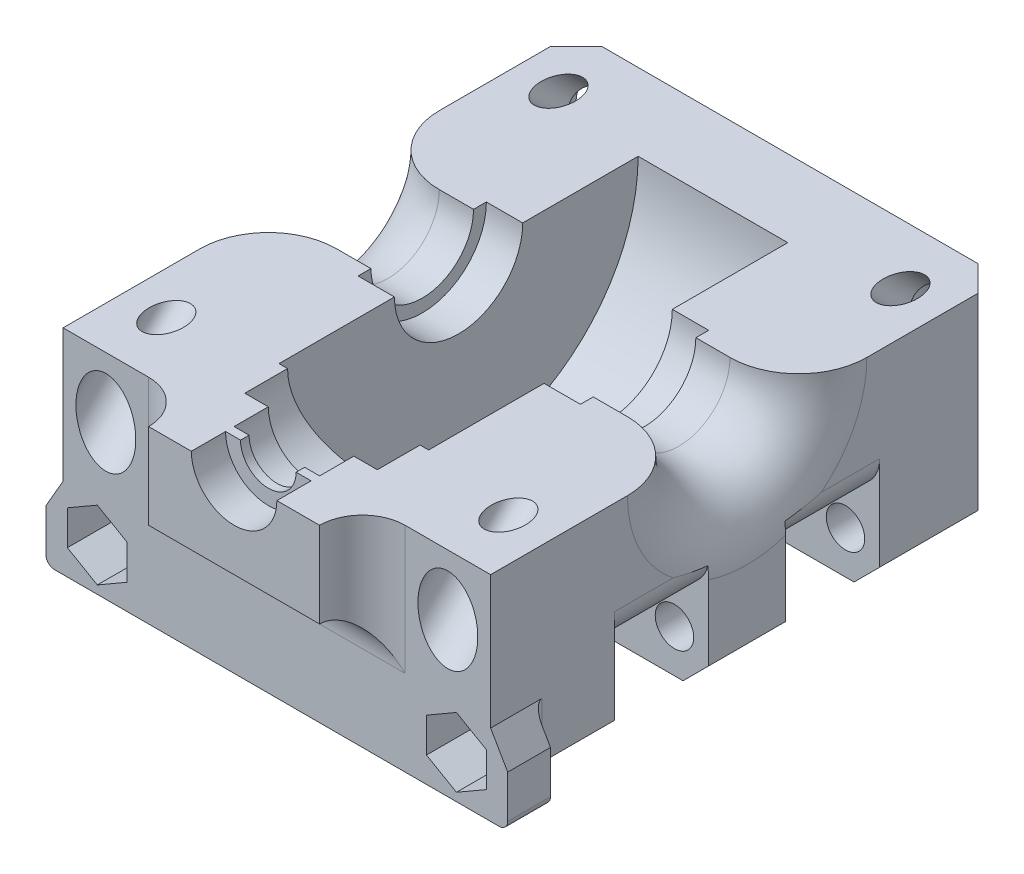
from build123d import *

# Parameters (mm, degrees)
SKETCH1_W                = 50
SKETCH1_H                = 60
BOSS_EXTRUDE1_DEPTH      = 25
CUT_EXTRUDE1_START       = -16.25
SKETCH2_R                = 21
CUT_EXTRUDE1_DEPTH       = 17.5
CUT_EXTRUDE2_START       = -12
SKETCH3_R                = 7.5
CUT_EXTRUDE2_DEPTH       = 26
SKETCH4_R                = 5
CUT_EXTRUDE3_DEPTH       = 4
SKETCH10_W               = 11
SKETCH10_H               = 10
CUT_EXTRUDE9_DEPTH       = 11
SKETCH11_R               = 2.25
CUT_EXTRUDE10_DEPTH      = 50.398886627
SKETCH12_R               = 2
CUT_EXTRUDE11_DEPTH      = 50.371044145
SKETCH13_R               = 3.5
CUT_EXTRUDE12_DEPTH      = 50.371044145
CHAMFER1_SIZE            = 3
FILLET1_R                = 4
SKETCH14_R               = 1.8
CUT_EXTRUDE13_DEPTH      = 10
CUT_EXTRUDE14_DEPTH      = 7
BOSS_EXTRUDE2_DEPTH      = 5
CHAMFER2_SIZE            = 3
FILLET2_R                = 1
CUT_EXTRUDE15_DEPTH      = 66.030761952
CUT_EXTRUDE15_DEPTH_BACK = 66.030761952
SKETCH17_R               = 6
SKETCH21_R               = 7.75
CUT_EXTRUDE16_DEPTH      = 8
SKETCH22_W               = 20
SKETCH22_H               = 10
BOSS_EXTRUDE3_DEPTH      = 5
SKETCH23_R               = 3.25
CUT_EXTRUDE17_DEPTH      = 5
SKETCH24_R               = 5
CUT_EXTRUDE18_DEPTH      = 4
FILLET4_R                = 5
SKETCH25_R               = 1.5
CUT_EXTRUDE19_DEPTH      = 8
SKETCH26_R               = 3.6
CUT_EXTRUDE20_DEPTH      = 10


with BuildPart() as part:
    # Sketch1 → Boss-Extrude1 (new body)
    with BuildSketch(Plane(origin=(0, 0, 0), x_dir=(1, 0, 0), z_dir=(0, 1, 0))):
        Rectangle(SKETCH1_W, SKETCH1_H)
    extrude(amount=BOSS_EXTRUDE1_DEPTH)

    # Sketch2 → Cut-Extrude1 (cut)
    with BuildSketch(Plane.ZY.offset(25).offset(CUT_EXTRUDE1_START)):
        with Locations((0, 25)):
            Circle(SKETCH2_R)
    extrude(amount=-CUT_EXTRUDE1_DEPTH, mode=Mode.SUBTRACT)

    # Sketch3 → Cut-Extrude2 (cut)
    with BuildSketch(Plane.ZY.offset(25).offset(CUT_EXTRUDE2_START)):
        with Locations((0, 25)):
            Circle(SKETCH3_R)
    extrude(amount=-CUT_EXTRUDE2_DEPTH, mode=Mode.SUBTRACT)

    # Sketch4 → Cut-Extrude3 (cut)
    with BuildSketch(Plane.XY.offset(30)):
        with Locations((0, 25)):
            Circle(SKETCH4_R)
    extrude(amount=-CUT_EXTRUDE3_DEPTH, mode=Mode.SUBTRACT)

    # Sketch10 → Cut-Extrude9 (cut)
    with BuildSketch(Plane(origin=(25, 0, 0), x_dir=(0, 0, -1), z_dir=(1, 0, 0))):
        with Locations((-10, 5)):
            Rectangle(SKETCH10_W, SKETCH10_H)
        with Locations((10, 5)):
            Rectangle(SKETCH10_W, SKETCH10_H)
    cut_extrude9 = extrude(amount=-CUT_EXTRUDE9_DEPTH, mode=Mode.SUBTRACT)

    # Sketch11 → Cut-Extrude10 (cut, symmetric)
    with BuildSketch(Plane(origin=(0, 0, -4.5), x_dir=(-1, 0, 0), z_dir=(0, 0, -1))):
        with Locations(Location((-21, 5, 0), (0, 0, 90))):
            Circle(SKETCH11_R)
    cut_extrude10 = extrude(amount=CUT_EXTRUDE10_DEPTH, both=True, mode=Mode.SUBTRACT)

    # Mirror1: Cut-Extrude9, Cut-Extrude10 across plane
    add(cut_extrude9.mirror(Plane(origin=(0, 0, 0), x_dir=(0, 0, 1), z_dir=(1, 0, 0))), mode=Mode.SUBTRACT)
    add(cut_extrude10.mirror(Plane(origin=(0, 0, 0), x_dir=(0, 0, 1), z_dir=(1, 0, 0))), mode=Mode.SUBTRACT)

    # Sketch12 → Cut-Extrude11 (cut, symmetric)
    with BuildSketch(Plane(origin=(0, -2.5, 2.5), x_dir=(1, 0, 0), z_dir=(0, -0.7071067811865475, 0.7071067811865477))):
        with Locations(Location((20, 33.890872965, 0), (0, 0, 270))):
            Circle(SKETCH12_R)
        with Locations(Location((-20, 33.890872965, 0), (0, 0, 270))):
            Circle(SKETCH12_R)
    cut_extrude11 = extrude(amount=CUT_EXTRUDE11_DEPTH, both=True, mode=Mode.SUBTRACT)

    # Sketch13 → Cut-Extrude12 (cut, through all)
    with BuildSketch(Plane(origin=(0, -2.5, 2.5), x_dir=(1, 0, 0), z_dir=(0, -0.7071067811865475, 0.7071067811865477))):
        with Locations(Location((-20, 33.890872965, 0), (0, 0, 90))):
            Circle(SKETCH13_R)
        with Locations(Location((20, 33.890872965, 0), (0, 0, 90))):
            Circle(SKETCH13_R)
    cut_extrude12 = extrude(amount=CUT_EXTRUDE12_DEPTH, mode=Mode.SUBTRACT)

    # Mirror3: Cut-Extrude11, Cut-Extrude12 across plane
    add(cut_extrude11.mirror(Plane.XY), mode=Mode.SUBTRACT)
    add(cut_extrude12.mirror(Plane.XY), mode=Mode.SUBTRACT)

    # Chamfer1
    # the kernel refuses this chamfer: 3 mm, written as the material it takes off along each edge
    with BuildSketch(Plane(origin=(25, -7.715048964, -30), x_dir=(-1, 0, 0), z_dir=(0, 1, 0))) as chamfer1_piece_1:
        Polygon((CHAMFER1_SIZE, 0), (0, CHAMFER1_SIZE), (0, 0), align=None)
    extrude(amount=40.430097928, mode=Mode.SUBTRACT)
    with BuildSketch(Plane(origin=(-25, -7.715048964, -30), x_dir=(1, 0, 0), z_dir=(0, 1, 0))) as chamfer1_piece_2:
        Polygon((CHAMFER1_SIZE, 0), (0, -CHAMFER1_SIZE), (0, 0), align=None)
    extrude(amount=40.430097928, mode=Mode.SUBTRACT)

    # Fillet1
    fillet1_edges = [part.edges().sort_by_distance(p)[0] for p in [
        (-25, 10, -10),
        (25, 10, 10),
        (25, 10, -10),
        (-25, 10, 10),
    ]]
    fillet(fillet1_edges, radius=FILLET1_R)

    # Sketch14 → Cut-Extrude13 (cut)
    with BuildSketch(Plane.XZ):
        with Locations(Location((-15, -20.205680561, 0), (0, 0, 270))):
            Circle(SKETCH14_R)
        with Locations(Location((15, -20.205680561, 0), (0, 0, 270))):
            Circle(SKETCH14_R)
    extrude(amount=-CUT_EXTRUDE13_DEPTH, mode=Mode.SUBTRACT)

    # Sketch15 → Cut-Extrude14 (cut)
    with BuildSketch(Plane.XY.offset(30)):
        Polygon((-21, 0.958548116), (-17.5, 2.979274058), (-17.5, 7.020725942), (-21, 9.041451884), (-24.5, 7.020725942), (-24.5, 2.979274058), align=None)
        Polygon((21, 0.958548116), (24.5, 2.979274058), (24.5, 7.020725942), (21, 9.041451884), (17.5, 7.020725942), (17.5, 2.979274058), align=None)
    extrude(amount=-CUT_EXTRUDE14_DEPTH, mode=Mode.SUBTRACT)

    # Sketch16 → Boss-Extrude2 (add)
    with BuildSketch(Plane.XY.offset(30)):
        with BuildLine():
            Line((-25, 0), (-25, 9.464101615))
            Line((-25, 9.464101615), (-27, 6))
            Line((-27, 6), (-27, 1))
            ThreePointArc((-27, 1), (-26.707106781, 0.292893219), (-26, 0))
            Line((-26, 0), (-25, 0))
        make_face()
    boss_extrude2 = extrude(amount=-BOSS_EXTRUDE2_DEPTH)

    # Mirror4: Boss-Extrude2 across plane
    add(boss_extrude2.mirror(Plane(origin=(0, 0, 0), x_dir=(0, 0, 1), z_dir=(1, 0, 0))))

    # Chamfer2
    # the kernel refuses this chamfer: 3 mm, written as the material it takes off along each edge
    with BuildSketch(Plane(origin=(-25, 0, 25), x_dir=(0, 1, 0), z_dir=(0, 0, -1))) as chamfer2_piece_1:
        Polygon((CHAMFER2_SIZE, 0), (0, CHAMFER2_SIZE), (0, 0), align=None)
    extrude(amount=17.215048964, mode=Mode.SUBTRACT)
    with BuildSketch(Plane(origin=(-25, 0, 12.215048964), x_dir=(0, 1, 0), z_dir=(0, 0, -1))) as chamfer2_piece_2:
        Polygon((CHAMFER2_SIZE, 0), (0, CHAMFER2_SIZE), (0, 0), align=None)
    extrude(amount=24.430097928, mode=Mode.SUBTRACT)
    with BuildSketch(Plane(origin=(-25, 0, -7.784951036), x_dir=(0, 1, 0), z_dir=(0, 0, -1))) as chamfer2_piece_3:
        Polygon((CHAMFER2_SIZE, 0), (0, CHAMFER2_SIZE), (0, 0), align=None)
    extrude(amount=26.930097928, mode=Mode.SUBTRACT)
    with BuildSketch(Plane(origin=(-16.54463656, 0, -35.45536344), x_dir=(0, 1, 0), z_dir=(-0.7071067811865476, 0, 0.7071067811865476))) as chamfer2_piece_4:
        Polygon((CHAMFER2_SIZE, 0), (0, -CHAMFER2_SIZE), (0, 0), align=None)
    extrude(amount=19.672738615, mode=Mode.SUBTRACT)
    with BuildSketch(Plane(origin=(-29.715048964, 0, -30), x_dir=(0, 1, 0), z_dir=(1, 0, 0))) as chamfer2_piece_5:
        Polygon((CHAMFER2_SIZE, 0), (0, CHAMFER2_SIZE), (0, 0), align=None)
    extrude(amount=59.430097928, mode=Mode.SUBTRACT)
    with BuildSketch(Plane(origin=(16.54463656, 0, -35.45536344), x_dir=(0, 1, 0), z_dir=(0.7071067811865476, 0, 0.7071067811865476))) as chamfer2_piece_6:
        Polygon((CHAMFER2_SIZE, 0), (0, CHAMFER2_SIZE), (0, 0), align=None)
    extrude(amount=19.672738615, mode=Mode.SUBTRACT)
    with BuildSketch(Plane(origin=(25, 0, -34.715048964), x_dir=(-1, 0, 0), z_dir=(0, 0, 1))) as chamfer2_piece_7:
        Polygon((CHAMFER2_SIZE, 0), (0, -CHAMFER2_SIZE), (0, 0), align=None)
    extrude(amount=26.930097928, mode=Mode.SUBTRACT)
    with BuildSketch(Plane(origin=(25, 0, 7.784951036), x_dir=(-1, 0, 0), z_dir=(0, 0, 1))) as chamfer2_piece_8:
        Polygon((CHAMFER2_SIZE, 0), (0, -CHAMFER2_SIZE), (0, 0), align=None)
    extrude(amount=17.215048964, mode=Mode.SUBTRACT)
    with BuildSketch(Plane(origin=(25, 0, -12.215048964), x_dir=(-1, 0, 0), z_dir=(0, 0, 1))) as chamfer2_piece_9:
        Polygon((CHAMFER2_SIZE, 0), (0, -CHAMFER2_SIZE), (0, 0), align=None)
    extrude(amount=24.430097928, mode=Mode.SUBTRACT)

    # Fillet2
    fillet2_edges = [part.edges().sort_by_distance(p)[0] for p in [
        (-25, 6.232050808, 25),
        (25, 6.232050808, 25),
        (-23.5, 1.5, 25),
        (23.5, 1.5, 25),
    ]]
    fillet(fillet2_edges, radius=FILLET2_R)

    # Sketch17 → Cut-Extrude15 (cut, two sides: drawn at the far end of the back side and taken through both)
    with BuildSketch(Plane.ZY.offset(25).offset(-CUT_EXTRUDE15_DEPTH_BACK)):
        with Locations((0, 25)):
            Circle(SKETCH17_R)
    extrude(amount=CUT_EXTRUDE15_DEPTH + CUT_EXTRUDE15_DEPTH_BACK, mode=Mode.SUBTRACT)

    # Fillet3: read off the stored shape, not the designer's step
    # Fillet3 outline → Fillet3 (revolve, cut)
    with BuildSketch(Plane(origin=(0, 25, 0), x_dir=(0, 1, 0), z_dir=(0, 0, -1))):
        with BuildLine():
            Line((6, 25), (6, 17))
            ThreePointArc((6, 17), (8.343145751, 22.656854249), (14, 25))
            Line((14, 25), (6, 25))
        make_face()
        with BuildLine():
            ThreePointArc((14, -25), (8.343145751, -22.656854249), (6, -17))
            Line((6, -17), (6, -25))
            Line((6, -25), (14, -25))
        make_face()
    revolve(axis=Axis((0, 25, 0), (1, 0, 0)), mode=Mode.SUBTRACT)

    # Sketch21 → Cut-Extrude16 (cut)
    with BuildSketch(Plane.XY.offset(26)):
        with Locations((0, 25)):
            Circle(SKETCH21_R)
    extrude(amount=-CUT_EXTRUDE16_DEPTH, mode=Mode.SUBTRACT)

    # Sketch22 → Boss-Extrude3 (add)
    with BuildSketch(Plane.XY.offset(30)):
        with Locations((0, 20)):
            Rectangle(SKETCH22_W, SKETCH22_H)
    extrude(amount=BOSS_EXTRUDE3_DEPTH)

    # Sketch23 → Cut-Extrude17 (cut)
    with BuildSketch(Plane.XY.offset(35)):
        with Locations((0, 25)):
            Circle(SKETCH23_R)
    extrude(amount=-CUT_EXTRUDE17_DEPTH, mode=Mode.SUBTRACT)

    # Sketch24 → Cut-Extrude18 (cut)
    with BuildSketch(Plane.XY.offset(35)):
        with Locations((0, 25)):
            Circle(SKETCH24_R)
    extrude(amount=-CUT_EXTRUDE18_DEPTH, mode=Mode.SUBTRACT)

    # Fillet4
    fillet4_edges = [part.edges().sort_by_distance(p)[0] for p in [
        (-10, 20, 30),
        (0, 15, 30),
        (10, 20, 30),
    ]]
    fillet(fillet4_edges, radius=FILLET4_R - 0.0001)  # a hair under: the kernel refuses the full size

    # Sketch25 → Cut-Extrude19 (cut)
    with BuildSketch(Plane.XZ):
        with Locations(Location((10, 23, 0), (0, 0, 270))):
            Circle(SKETCH25_R)
        with Locations(Location((-10, 23, 0), (0, 0, 270))):
            Circle(SKETCH25_R)
        with Locations(Location((10, 13, 0), (0, 0, 270))):
            Circle(SKETCH25_R)
        with Locations(Location((-10, 13, 0), (0, 0, 270))):
            Circle(SKETCH25_R)
    extrude(amount=-CUT_EXTRUDE19_DEPTH, mode=Mode.SUBTRACT)

    # Sketch26 → Cut-Extrude20 (cut)
    with BuildSketch(Plane(origin=(0, 0, -30), x_dir=(-1, 0, 0), z_dir=(0, 0, -1))):
        with Locations((21, 5)):
            Circle(SKETCH26_R)
        with Locations((-21, 5)):
            Circle(SKETCH26_R)
    extrude(amount=-CUT_EXTRUDE20_DEPTH, mode=Mode.SUBTRACT)


solid = part.part
